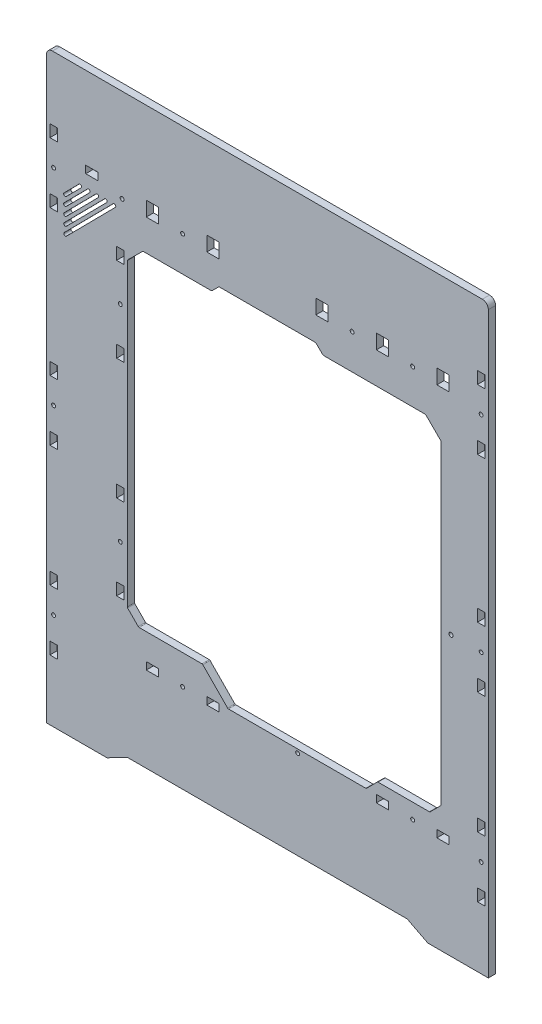
from build123d import *

# Parameters (mm, degrees)
SKETCH_1_W      = 6.1
SKETCH_1_H      = 10
SKETCH_1_R      = 1.6
SKETCH_1_W_2    = 10
SKETCH_1_H_2    = 6.1
SKETCH_1_R_2    = 1.7
SKETCH_1_H_3    = 12.1
EXTRUDE_1_DEPTH = 6


with BuildPart() as part:
    # Эскиз1 → Бобышка-Вытянуть1 (new body)
    with BuildSketch(Plane.XY):
        with BuildLine():
            Line((768.366546195, 520.00723929), (768.366546195, 485.00723929))
            Line((768.366546195, 485.00723929), (768.366546195, 477.00723929))
            Line((768.366546195, 477.00723929), (768.366546195, 42.00723929))
            Line((768.366546195, 42.00723929), (818.366546195, 42.00723929))
            Line((818.366546195, 42.00723929), (835.366546195, 50.73749629))
            Line((835.366546195, 50.73749629), (1066.366546195, 50.73749629))
            Line((1066.366546195, 50.73749629), (1083.366546195, 42.00723929))
            Line((1083.366546195, 42.00723929), (1133.366546195, 42.00723929))
            Line((1133.366546195, 42.00723929), (1133.366546195, 477.00723929))
            Line((1133.366546195, 477.00723929), (1133.366546195, 485.00723929))
            Line((1133.366546195, 485.00723929), (1133.366546195, 520.00723929))
            ThreePointArc((1133.366546195, 520.00723929), (1131.902080101, 523.542773196), (1128.366546195, 525.00723929))
            Line((1128.366546195, 525.00723929), (773.366546195, 525.00723929))
            ThreePointArc((773.366546195, 525.00723929), (769.831012289, 523.542773196), (768.366546195, 520.00723929))
        make_face()
        with Locations((774.316546195, 97.00723929)):
            Rectangle(SKETCH_1_W, SKETCH_1_H, mode=Mode.SUBTRACT)
        with Locations((774.316546195, 122.00723929)):
            Circle(SKETCH_1_R, mode=Mode.SUBTRACT)
        with Locations((774.316546195, 147.00723929)):
            Rectangle(SKETCH_1_W, SKETCH_1_H, mode=Mode.SUBTRACT)
        with Locations((855.866546195, 124.05491429)):
            Rectangle(SKETCH_1_W_2, SKETCH_1_H_2, mode=Mode.SUBTRACT)
        with Locations((880.866546195, 124.05491429)):
            Circle(SKETCH_1_R, mode=Mode.SUBTRACT)
        with Locations((905.866546195, 124.05491429)):
            Rectangle(SKETCH_1_W_2, SKETCH_1_H_2, mode=Mode.SUBTRACT)
        with Locations((829.416546195, 166.80723929)):
            Rectangle(SKETCH_1_W, SKETCH_1_H, mode=Mode.SUBTRACT)
        with Locations((829.416546195, 202.00723929)):
            Circle(SKETCH_1_R, mode=Mode.SUBTRACT)
        with Locations((774.316546195, 247.00723929)):
            Rectangle(SKETCH_1_W, SKETCH_1_H, mode=Mode.SUBTRACT)
        with Locations((774.316546195, 272.00723929)):
            Circle(SKETCH_1_R, mode=Mode.SUBTRACT)
        with Locations((829.416546195, 236.80723929)):
            Rectangle(SKETCH_1_W, SKETCH_1_H, mode=Mode.SUBTRACT)
        with Locations((975.866546195, 124.05491402)):
            Circle(SKETCH_1_R, mode=Mode.SUBTRACT)
        with Locations((1127.416546195, 97.00723929)):
            Rectangle(SKETCH_1_W, SKETCH_1_H, mode=Mode.SUBTRACT)
        with Locations((1045.866546195, 124.05491429)):
            Rectangle(SKETCH_1_W_2, SKETCH_1_H_2, mode=Mode.SUBTRACT)
        with Locations((1070.866546195, 124.05491429)):
            Circle(SKETCH_1_R, mode=Mode.SUBTRACT)
        with Locations((1095.866546195, 124.05491429)):
            Rectangle(SKETCH_1_W_2, SKETCH_1_H_2, mode=Mode.SUBTRACT)
        with Locations((1127.416546195, 122.00723929)):
            Circle(SKETCH_1_R, mode=Mode.SUBTRACT)
        with Locations((1127.416546195, 147.00723929)):
            Rectangle(SKETCH_1_W, SKETCH_1_H, mode=Mode.SUBTRACT)
        with BuildLine():
            Line((991.452332632, 424.583526443), (996.280759757, 419.755099318))
            ThreePointArc((996.280759757, 419.755099318), (996.929606455, 419.321553816), (997.694973319, 419.169312881))
            Line((997.694973319, 419.169312881), (1081.122260515, 419.169312881))
            ThreePointArc((1081.122260515, 419.169312881), (1081.50331118, 419.093867148), (1081.826864515, 418.878913881))
            Line((1081.826864515, 418.878913881), (1094.120077515, 406.672272881))
            ThreePointArc((1094.120077515, 406.672272881), (1094.338675602, 406.346986998), (1094.415473515, 405.962671881))
            Line((1094.415473515, 405.962671881), (1094.415473515, 146.420031881))
            ThreePointArc((1094.415473515, 146.420031881), (1094.340368819, 146.039810505), (1094.126336515, 145.716701881))
            Line((1094.126336515, 145.716701881), (1085.357153515, 136.853593881))
            ThreePointArc((1085.357153515, 136.853593881), (1085.031432616, 136.634066807), (1084.646289515, 136.556923881))
            Line((1084.646289515, 136.556923881), (1042.289008515, 136.556923881))
            ThreePointArc((1042.289008515, 136.556923881), (1041.903865529, 136.479781416), (1041.578144515, 136.260254881))
            Line((1041.578144515, 136.260254881), (1032.813350515, 127.401582881))
            ThreePointArc((1032.813350515, 127.401582881), (1032.487630078, 127.182055999), (1032.102487515, 127.104912881))
            Line((1032.102487515, 127.104912881), (918.728979515, 127.104912881))
            ThreePointArc((918.728979515, 127.104912881), (918.34230769, 127.182695398), (918.015788515, 127.403942881))
            Line((918.015788515, 127.403942881), (897.574498515, 148.201603881))
            ThreePointArc((897.574498515, 148.201603881), (897.24797934, 148.422851364), (896.861307515, 148.500633881))
            Line((896.861307515, 148.500633881), (844.938460515, 148.500633881))
            ThreePointArc((844.938460515, 148.500633881), (844.553318068, 148.577776538), (844.227597515, 148.797302881))
            Line((844.227597515, 148.797302881), (835.458413515, 157.660410881))
            ThreePointArc((835.458413515, 157.660410881), (835.244381748, 157.983519619), (835.169277515, 158.363740881))
            Line((835.169277515, 158.363740881), (835.169277515, 405.962671881))
            ThreePointArc((835.169277515, 405.962671881), (835.246075427, 406.346986998), (835.464673515, 406.672272881))
            Line((835.464673515, 406.672272881), (847.757886515, 418.878913881))
            ThreePointArc((847.757886515, 418.878913881), (848.08143985, 419.093867148), (848.462490515, 419.169312881))
            Line((848.462490515, 419.169312881), (904.03811907, 419.169312881))
            ThreePointArc((904.03811907, 419.169312881), (904.803485935, 419.321553816), (905.452332632, 419.755099318))
            Line((905.452332632, 419.755099318), (910.280759757, 424.583526443))
            ThreePointArc((910.280759757, 424.583526443), (910.929606455, 425.017071946), (911.694973319, 425.169312881))
            Line((911.694973319, 425.169312881), (990.03811907, 425.169312881))
            ThreePointArc((990.03811907, 425.169312881), (990.803485935, 425.017071946), (991.452332632, 424.583526443))
        make_face(mode=Mode.SUBTRACT)
        with Locations((1127.416546195, 247.00723929)):
            Rectangle(SKETCH_1_W, SKETCH_1_H, mode=Mode.SUBTRACT)
        with Locations((1102.521049053, 272.00723929)):
            Circle(SKETCH_1_R_2, mode=Mode.SUBTRACT)
        with Locations((1127.416546195, 272.00723929)):
            Circle(SKETCH_1_R, mode=Mode.SUBTRACT)
        with Locations((774.316546195, 297.00723929)):
            Rectangle(SKETCH_1_W, SKETCH_1_H, mode=Mode.SUBTRACT)
        with Locations((829.416546195, 336.80723929)):
            Rectangle(SKETCH_1_W, SKETCH_1_H, mode=Mode.SUBTRACT)
        with Locations((829.416546195, 372.00723929)):
            Circle(SKETCH_1_R, mode=Mode.SUBTRACT)
        with Locations((774.316546195, 417.00723929)):
            Rectangle(SKETCH_1_W, SKETCH_1_H, mode=Mode.SUBTRACT)
        with BuildLine():
            Line((797.021693195, 438.99752529), (784.715878195, 426.55498029))
            ThreePointArc((784.715878195, 426.55498029), (782.948138695, 426.54521379), (782.938372195, 428.31295329))
            Line((782.938372195, 428.31295329), (795.244186195, 440.75549829))
            ThreePointArc((795.244186195, 440.75549829), (797.011926195, 440.76526529), (797.021693195, 438.99752529))
        make_face(mode=Mode.SUBTRACT)
        with BuildLine():
            Line((818.234572195, 439.11472329), (784.833077195, 405.34210029))
            ThreePointArc((784.833077195, 405.34210029), (783.065337195, 405.33233329), (783.055570195, 407.10007329))
            Line((783.055570195, 407.10007329), (816.457066195, 440.87269729))
            ThreePointArc((816.457066195, 440.87269729), (818.224806195, 440.88246329), (818.234572195, 439.11472329))
        make_face(mode=Mode.SUBTRACT)
        with BuildLine():
            Line((811.163612195, 439.07565729), (784.794011195, 412.41306029))
            ThreePointArc((784.794011195, 412.41306029), (783.026271195, 412.40329329), (783.016504195, 414.17103329))
            Line((783.016504195, 414.17103329), (809.386106195, 440.83363129))
            ThreePointArc((809.386106195, 440.83363129), (811.153846195, 440.84339729), (811.163612195, 439.07565729))
        make_face(mode=Mode.SUBTRACT)
        with BuildLine():
            Line((804.092652195, 439.03659129), (784.754944195, 419.48402029))
            ThreePointArc((784.754944195, 419.48402029), (782.987204695, 419.47425379), (782.977438195, 421.24199329))
            Line((782.977438195, 421.24199329), (802.315146195, 440.79456529))
            ThreePointArc((802.315146195, 440.79456529), (804.082886195, 440.80433129), (804.092652195, 439.03659129))
        make_face(mode=Mode.SUBTRACT)
        with BuildLine():
            Line((825.305532195, 439.15378929), (784.872143195, 398.27114029))
            ThreePointArc((784.872143195, 398.27114029), (783.104403195, 398.26137329), (783.094636195, 400.02911329))
            Line((783.094636195, 400.02911329), (823.528026195, 440.91176329))
            ThreePointArc((823.528026195, 440.91176329), (825.295766195, 440.92152929), (825.305532195, 439.15378929))
        make_face(mode=Mode.SUBTRACT)
        with Locations((774.316546195, 442.00723929)):
            Circle(SKETCH_1_R, mode=Mode.SUBTRACT)
        with Locations((805.866546195, 454.05723929)):
            Rectangle(SKETCH_1_W_2, SKETCH_1_H_2, mode=Mode.SUBTRACT)
        with Locations((829.416546195, 406.80723929)):
            Rectangle(SKETCH_1_W, SKETCH_1_H, mode=Mode.SUBTRACT)
        with Locations((830.866546195, 448.05723929)):
            Circle(SKETCH_1_R, mode=Mode.SUBTRACT)
        with Locations((855.866546195, 451.05723929)):
            Rectangle(SKETCH_1_W_2, SKETCH_1_H_3, mode=Mode.SUBTRACT)
        with Locations((774.316546195, 467.00723929)):
            Rectangle(SKETCH_1_W, SKETCH_1_H, mode=Mode.SUBTRACT)
        with Locations((880.866546195, 448.05723929)):
            Circle(SKETCH_1_R, mode=Mode.SUBTRACT)
        with Locations((905.866546195, 451.05723929)):
            Rectangle(SKETCH_1_W_2, SKETCH_1_H_3, mode=Mode.SUBTRACT)
        with Locations((1127.416546195, 297.00723929)):
            Rectangle(SKETCH_1_W, SKETCH_1_H, mode=Mode.SUBTRACT)
        with Locations((995.866546195, 451.05723929)):
            Rectangle(SKETCH_1_W_2, SKETCH_1_H_3, mode=Mode.SUBTRACT)
        with Locations((1020.866546195, 448.05723929)):
            Circle(SKETCH_1_R, mode=Mode.SUBTRACT)
        with Locations((1045.866546195, 451.05723929)):
            Rectangle(SKETCH_1_W_2, SKETCH_1_H_3, mode=Mode.SUBTRACT)
        with Locations((1070.866546195, 448.05723929)):
            Circle(SKETCH_1_R, mode=Mode.SUBTRACT)
        with Locations((1127.416546195, 417.00723929)):
            Rectangle(SKETCH_1_W, SKETCH_1_H, mode=Mode.SUBTRACT)
        with Locations((1095.866546195, 451.05723929)):
            Rectangle(SKETCH_1_W_2, SKETCH_1_H_3, mode=Mode.SUBTRACT)
        with Locations((1127.416546195, 442.00723929)):
            Circle(SKETCH_1_R, mode=Mode.SUBTRACT)
        with Locations((1127.416546195, 467.00723929)):
            Rectangle(SKETCH_1_W, SKETCH_1_H, mode=Mode.SUBTRACT)
    extrude(amount=EXTRUDE_1_DEPTH)


solid = part.part
